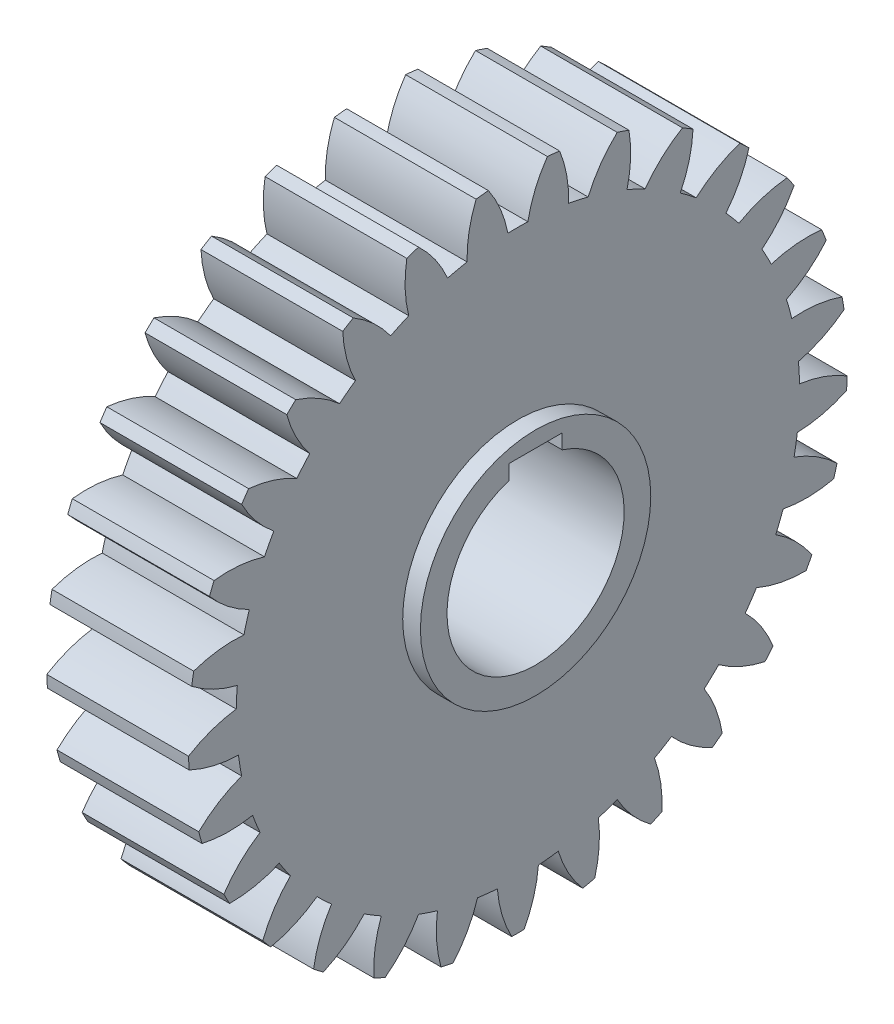
from build123d import *

# Parameters (mm, degrees)
BASPROSKE_W             = 4
BASPROSKE_H             = 9.3
TOOTHCUT_DEPTH          = 14.746999673
TEETHCUTS_COUNT         = 29
TEETHCUTS_ANGLE         = 347.586206897
BORSKE_R                = 2.5
BORE_DEPTH              = 50.0000508
EXTRUDE1_DEPTH          = 4.5
EXTRUDE1_DEPTH_BACK     = 0.5
SKETCH1_R               = 3.25
SKETCH1_R_2             = 2.5
CUT_EXTRUDE1_DEPTH      = 20
CUT_EXTRUDE1_DEPTH_BACK = 14.896807231
SKETCH2_W               = 1.5
SKETCH2_H               = 2.8


with BuildPart() as part:
    # BasProSke → Base-Revolve (revolve)
    with BuildSketch(Plane(origin=(0, 0, 0), x_dir=(1, 0, 0), z_dir=(0, 1, 0))):
        with Locations((2, 4.65)):
            Rectangle(BASPROSKE_W, BASPROSKE_H)
    revolve(axis=Axis((-10, 0, 0), (1, 0, 0)))

    # TooCutSke → ToothCut (cut, through all)
    with BuildSketch(Plane(origin=(0, 0, 0), x_dir=(0, 0, -1), z_dir=(1, 0, 0))):
        with BuildLine():
            ThreePointArc((0.281517973, 7.944013383), (0, 7.949), (-0.281517973, 7.944013383))
            ThreePointArc((-0.281517973, 7.944013383), (-0.494228582, 8.645390123), (-0.84911719, 9.28666168))
            ThreePointArc((-0.84911719, 9.28666168), (0, 9.3254), (0.84911719, 9.28666168))
            ThreePointArc((0.84911719, 9.28666168), (0.494228582, 8.645390123), (0.281517973, 7.944013383))
        make_face()
    toothcut = extrude(amount=TOOTHCUT_DEPTH, mode=Mode.SUBTRACT)

    # TeethCuts: ToothCut ×29 about axis
    teethcuts_axis = Axis((-10, 0, 0), (1, 0, 0))
    for i in range(1, TEETHCUTS_COUNT):
        add(toothcut.rotate(teethcuts_axis, i * TEETHCUTS_ANGLE / (TEETHCUTS_COUNT - 1)), mode=Mode.SUBTRACT)

    # BorSke → Bore (cut, symmetric)
    with BuildSketch(Plane(origin=(0, 0, 0), x_dir=(0, 0, -1), z_dir=(1, 0, 0))):
        Circle(BORSKE_R)
    extrude(amount=BORE_DEPTH, both=True, mode=Mode.SUBTRACT)

    # Sketch1 → Extrude1 (add, two sides: drawn at the far end of the back side and taken through both)
    with BuildSketch(Plane(origin=(0, 0, 0), x_dir=(0, 0, -1), z_dir=(1, 0, 0)).offset(-EXTRUDE1_DEPTH_BACK)):
        Circle(SKETCH1_R)
        Circle(SKETCH1_R_2, mode=Mode.SUBTRACT)
    extrude(amount=EXTRUDE1_DEPTH + EXTRUDE1_DEPTH_BACK)

    # Sketch2 → Cut-Extrude1 (cut, two sides: drawn at the far end of the back side and taken through both)
    with BuildSketch(Plane(origin=(0, 0, 0), x_dir=(0, 0, -1), z_dir=(1, 0, 0)).offset(-CUT_EXTRUDE1_DEPTH_BACK)):
        with Locations((0, 1.4)):
            Rectangle(SKETCH2_W, SKETCH2_H)
    extrude(amount=CUT_EXTRUDE1_DEPTH + CUT_EXTRUDE1_DEPTH_BACK, mode=Mode.SUBTRACT)


solid = part.part
